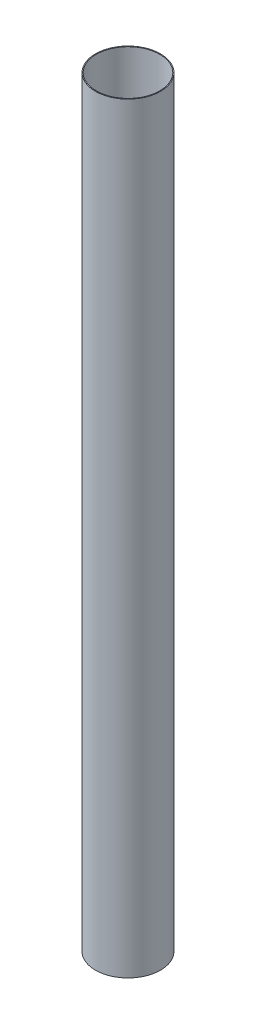
from build123d import *

# Parameters (mm, degrees)
SKETCH1_R           = 65.151
SKETCH1_R_2         = 63.5
BOSS_EXTRUDE1_DEPTH = 1524


with BuildPart() as part:
    # Sketch1 → Boss-Extrude1 (new body)
    with BuildSketch(Plane(origin=(0, 0, 0), x_dir=(1, 0, 0), z_dir=(0, 1, 0))):
        Circle(SKETCH1_R)
        Circle(SKETCH1_R_2, mode=Mode.SUBTRACT)
    extrude(amount=BOSS_EXTRUDE1_DEPTH)


solid = part.part
